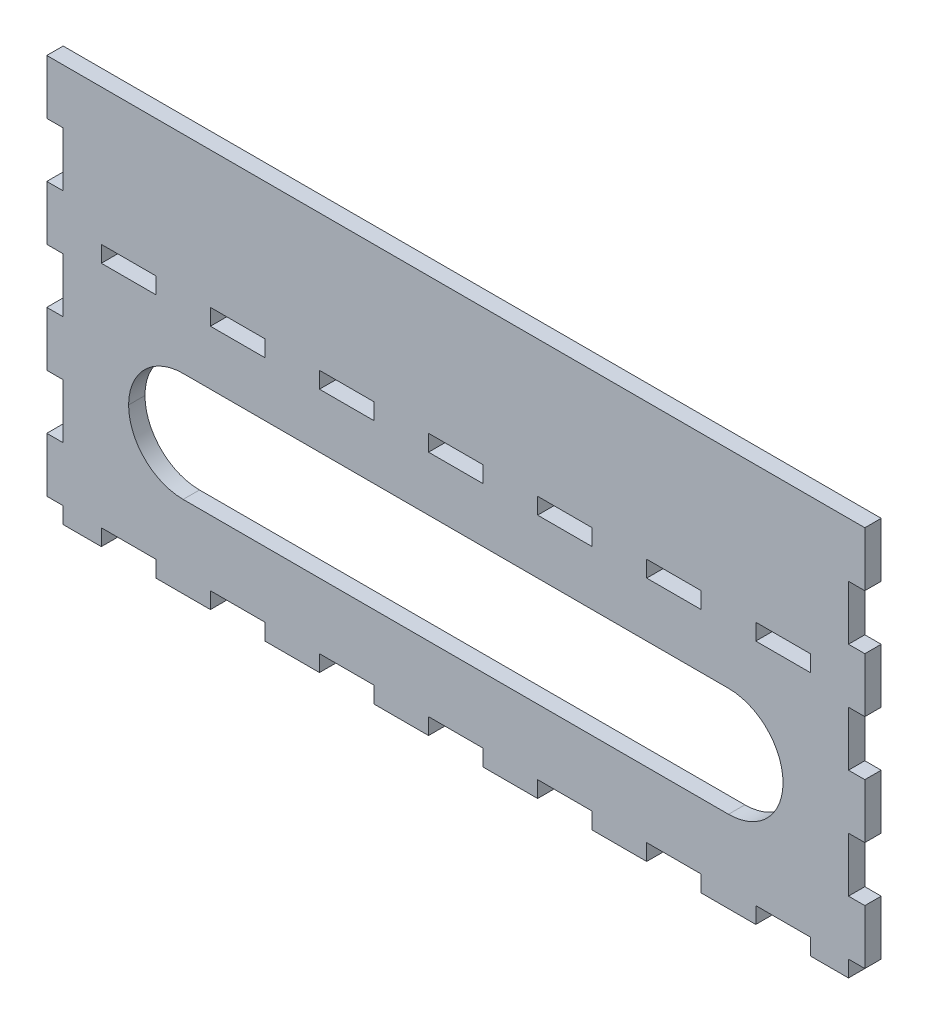
from build123d import *

# Parameters (mm, degrees)
SKETCH1_W               = 150
SKETCH1_H               = 73
BOSS_EXTRUDE1_DEPTH     = 3
SKETCH2_W               = 3
SKETCH2_H               = 10
CUT_EXTRUDE1_DEPTH      = 84.464064123
LPATTERN1_COUNT         = 4
LPATTERN1_PITCH         = 20
MIRROR3_COPY_1_SKETCH_W = 3
MIRROR3_COPY_1_SKETCH_H = 10
MIRROR3_COPY_1_DEPTH    = 84.464064123
MIRROR3_COPY_2_SKETCH_W = 3
MIRROR3_COPY_2_SKETCH_H = 10
MIRROR3_COPY_2_DEPTH    = 84.464064123
MIRROR3_COPY_3_SKETCH_W = 3
MIRROR3_COPY_3_SKETCH_H = 10
MIRROR3_COPY_3_DEPTH    = 84.464064123
SKETCH4_W               = 10
SKETCH4_H               = 3
CUT_EXTRUDE3_DEPTH      = 84.464064123
LPATTERN2_COUNT         = 8
LPATTERN2_PITCH         = 20
SKETCH5_W               = 10
SKETCH5_H               = 3
CUT_EXTRUDE4_DEPTH      = 84.464064123
LPATTERN4_COUNT         = 7
LPATTERN4_PITCH         = 20
SKETCH6_W               = 120
SKETCH6_H               = 20
CUT_EXTRUDE5_DEPTH      = 84.464064123
FILLET1_R               = 10


with BuildPart() as part:
    # Sketch1 → Boss-Extrude1 (new body)
    with BuildSketch(Plane.XY):
        Rectangle(SKETCH1_W, SKETCH1_H)
    extrude(amount=BOSS_EXTRUDE1_DEPTH)

    # Sketch2 → Cut-Extrude1 (cut, through all)
    with BuildSketch(Plane.XY.offset(3)):
        with Locations((-73.5, 21.5)):
            Rectangle(SKETCH2_W, SKETCH2_H)
    cut_extrude1 = extrude(amount=-CUT_EXTRUDE1_DEPTH, mode=Mode.SUBTRACT)

    # LPattern1: Cut-Extrude1 ×4
    with Locations(*[(0, -i * LPATTERN1_PITCH, 0) for i in range(1, LPATTERN1_COUNT)]):
        add(cut_extrude1, mode=Mode.SUBTRACT)

    # Mirror3: Cut-Extrude1 across plane
    add(cut_extrude1.mirror(Plane(origin=(0, 0, 0), x_dir=(0, 0, 1), z_dir=(1, 0, 0))), mode=Mode.SUBTRACT)

    # Mirror3 copy 1 sketch → Mirror3 copy 1 (cut, through all)
    with BuildSketch(Plane(origin=(0, -20, 3), x_dir=(-1, 0, 0), z_dir=(0, 0, 1))):
        with Locations((-73.5, -21.5)):
            Rectangle(MIRROR3_COPY_1_SKETCH_W, MIRROR3_COPY_1_SKETCH_H)
    extrude(amount=-MIRROR3_COPY_1_DEPTH, mode=Mode.SUBTRACT)

    # Mirror3 copy 2 sketch → Mirror3 copy 2 (cut, through all)
    with BuildSketch(Plane(origin=(0, -40, 3), x_dir=(-1, 0, 0), z_dir=(0, 0, 1))):
        with Locations((-73.5, -21.5)):
            Rectangle(MIRROR3_COPY_2_SKETCH_W, MIRROR3_COPY_2_SKETCH_H)
    extrude(amount=-MIRROR3_COPY_2_DEPTH, mode=Mode.SUBTRACT)

    # Mirror3 copy 3 sketch → Mirror3 copy 3 (cut, through all)
    with BuildSketch(Plane(origin=(0, -60, 3), x_dir=(-1, 0, 0), z_dir=(0, 0, 1))):
        with Locations((-73.5, -21.5)):
            Rectangle(MIRROR3_COPY_3_SKETCH_W, MIRROR3_COPY_3_SKETCH_H)
    extrude(amount=-MIRROR3_COPY_3_DEPTH, mode=Mode.SUBTRACT)

    # Sketch4 → Cut-Extrude3 (cut, through all)
    with BuildSketch(Plane.XY.offset(3)):
        with Locations((60, -35)):
            Rectangle(SKETCH4_W, SKETCH4_H)
    cut_extrude3 = extrude(amount=-CUT_EXTRUDE3_DEPTH, mode=Mode.SUBTRACT)

    # LPattern2: Cut-Extrude3 ×8
    with Locations(*[(-i * LPATTERN2_PITCH, 0, 0) for i in range(1, LPATTERN2_COUNT)]):
        add(cut_extrude3, mode=Mode.SUBTRACT)

    # Sketch5 → Cut-Extrude4 (cut, through all)
    with BuildSketch(Plane.XY.offset(3)):
        with Locations((-60, 10)):
            Rectangle(SKETCH5_W, SKETCH5_H)
    cut_extrude4 = extrude(amount=-CUT_EXTRUDE4_DEPTH, mode=Mode.SUBTRACT)

    # LPattern4: Cut-Extrude4 ×7
    with Locations(*[(i * LPATTERN4_PITCH, 0, 0) for i in range(1, LPATTERN4_COUNT)]):
        add(cut_extrude4, mode=Mode.SUBTRACT)

    # Sketch6 → Cut-Extrude5 (cut, through all)
    with BuildSketch(Plane.XY.offset(3)):
        with Locations((0, -11.5)):
            Rectangle(SKETCH6_W, SKETCH6_H)
    extrude(amount=-CUT_EXTRUDE5_DEPTH, mode=Mode.SUBTRACT)

    # Fillet1
    fillet1_edges = [part.edges().sort_by_distance(p)[0] for p in [
        (60, -1.5, 1.5),
        (60, -21.5, 1.5),
        (-60, -1.5, 1.5),
        (-60, -21.5, 1.5),
    ]]
    fillet(fillet1_edges, radius=FILLET1_R - 0.0001)  # a hair under: the kernel refuses the full size


solid = part.part
